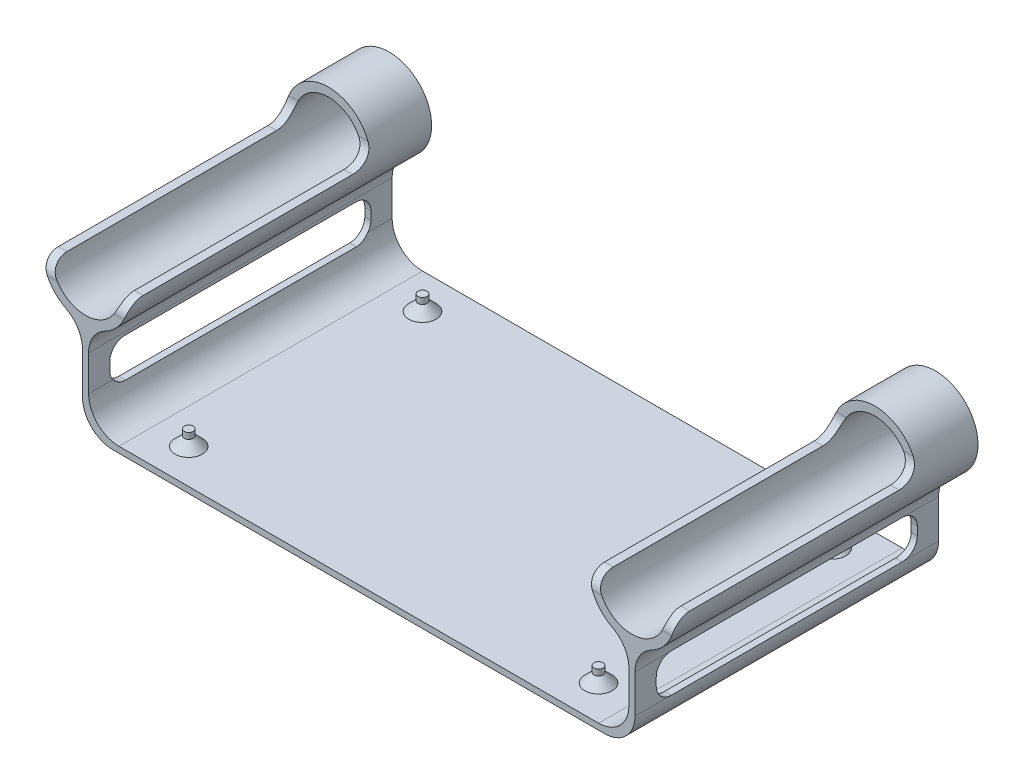
from build123d import *

# Parameters (mm, degrees)
SKETCH1_R           = 11.15
BOSS_EXTRUDE1_DEPTH = 100
FILLET1_R           = 10
SKETCH2_R           = 1.5
BOSS_EXTRUDE2_DEPTH = 5
CUT_EXTRUDE1_DEPTH  = 200
CHAMFER1_SIZE       = 3
SKETCH4_W           = 248.723360466
SKETCH4_H           = 67.445413608
CUT_EXTRUDE2_DEPTH  = 80
FILLET2_R           = 6
FILLET4_R           = 5


with BuildPart() as part:
    # Sketch1 → Boss-Extrude1 (new body)
    with BuildSketch(Plane.XY):
        with BuildLine():
            Line((180, -45), (181, -45))
            Line((181, -45), (181, -14.961450912))
            ThreePointArc((181, -14.961450912), (193.991057155, -0.496891277), (180, 13.002789132))
            ThreePointArc((180, 13.002789132), (166.008942845, -0.496891277), (179, -14.961450912))
            Line((179, -14.961450912), (179, -43))
            Line((179, -43), (1, -43))
            Line((1, -43), (1, -13.964240044))
            ThreePointArc((1, -13.964240044), (13.991057155, 0.500319591), (0, 14))
            ThreePointArc((0, 14), (-13.991057155, 0.500319591), (-1, -13.964240044))
            Line((-1, -13.964240044), (-1, -45))
            Line((-1, -45), (0, -45))
            Line((0, -45), (180, -45))
        make_face()
        Circle(SKETCH1_R, mode=Mode.SUBTRACT)
        with Locations((180, -0.997210868)):
            Circle(SKETCH1_R, mode=Mode.SUBTRACT)
    extrude(amount=BOSS_EXTRUDE1_DEPTH)

    # Fillet1
    fillet1_edges = [part.edges().sort_by_distance(p)[0] for p in [
        (181, -14.961450912, 50),
        (181, -45, 50),
        (-1, -45, 50),
        (-1, -13.964240044, 50),
        (1, -13.964240044, 50),
        (1, -43, 50),
        (179, -43, 50),
        (179, -14.961450912, 50),
    ]]
    fillet(fillet1_edges, radius=FILLET1_R)

    # Sketch2 → Boss-Extrude2 (add)
    with BuildSketch(Plane(origin=(0, -43, 0), x_dir=(1, 0, 0), z_dir=(0, 1, 0))):
        with Locations((157.5, -88.5)):
            Circle(SKETCH2_R)
        with Locations((22.5, -88.5)):
            Circle(SKETCH2_R)
        with Locations((22.5, -11.5)):
            Circle(SKETCH2_R)
        with Locations((157.5, -11.5)):
            Circle(SKETCH2_R)
    extrude(amount=BOSS_EXTRUDE2_DEPTH)

    # Sketch3 → Cut-Extrude1 (cut)
    with BuildSketch(Plane(origin=(181, 0, 0), x_dir=(0, 0, -1), z_dir=(1, 0, 0))):
        with BuildLine():
            Line((-88, -35), (-12, -35))
            ThreePointArc((-12, -35), (-8.464466094, -33.535533906), (-7, -30))
            Line((-7, -30), (-7, -27.327939876))
            ThreePointArc((-7, -27.327939876), (-8.464466094, -23.79240597), (-12, -22.327939876))
            Line((-12, -22.327939876), (-88, -22.327939876))
            ThreePointArc((-88, -22.327939876), (-91.535533906, -23.79240597), (-93, -27.327939876))
            Line((-93, -27.327939876), (-93, -30))
            ThreePointArc((-93, -30), (-91.535533906, -33.535533906), (-88, -35))
        make_face()
    extrude(amount=-CUT_EXTRUDE1_DEPTH, mode=Mode.SUBTRACT)

    # Chamfer1
    chamfer1_edges = [part.edges().sort_by_distance(p)[0] for p in [
        (21, -43, 88.5),
        (21, -43, 11.5),
        (156, -43, 11.5),
        (156, -43, 88.5),
    ]]
    chamfer(chamfer1_edges, length=CHAMFER1_SIZE)

    # Sketch4 → Cut-Extrude2 (cut)
    with BuildSketch(Plane.XY.offset(100)):
        with Locations((82.703627743, 32.722706804)):
            Rectangle(SKETCH4_W, SKETCH4_H)
    extrude(amount=-CUT_EXTRUDE2_DEPTH, mode=Mode.SUBTRACT)

    # Fillet2
    # the kernel refuses this fillet: 6 mm, written as the material it adds along each edge
    with BuildSketch(Plane(origin=(3.894933589, -1, 20), x_dir=(0, 0, 1), z_dir=(-1, 0, 0))) as fillet2_piece_1_section:
        with BuildLine():
            CenterArc((FILLET2_R, FILLET2_R), FILLET2_R, 180, 90)
            Line((0, FILLET2_R), (0, 0))
            Line((0, 0), (FILLET2_R, 0))
        make_face()
    fillet2_piece_1 = extrude(amount=32.859173632, mode=Mode.PRIVATE)
    fillet2_piece_1 = fillet2_piece_1 & Plane(origin=(0, 0, 21.353216392), x_dir=(0.07142857142857159, -0.9974457174120672, 0), z_dir=(0, 0, -1)) * Cylinder(14, 90, mode=Mode.PRIVATE)
    fillet2_piece_1 = fillet2_piece_1 - Plane(origin=(0, 0, 21.353216392), x_dir=(1, 0, 0), z_dir=(0, 0, -1)) * Cylinder(11.15, 90, mode=Mode.PRIVATE)
    add(fillet2_piece_1)
    with BuildSketch(Plane(origin=(28.964240044, -1, 20), x_dir=(0, 0, 1), z_dir=(-1, 0, 0))) as fillet2_piece_2_section:
        with BuildLine():
            CenterArc((FILLET2_R, FILLET2_R), FILLET2_R, 180, 90)
            Line((0, FILLET2_R), (0, 0))
            Line((0, 0), (FILLET2_R, 0))
        make_face()
    fillet2_piece_2 = extrude(amount=32.859173632, mode=Mode.PRIVATE)
    fillet2_piece_2 = fillet2_piece_2 & Plane(origin=(0, 0, 21.353217429), x_dir=(0.07142857142857159, -0.9974457174120672, 0), z_dir=(0, 0, -1)) * Cylinder(14, 90, mode=Mode.PRIVATE)
    fillet2_piece_2 = fillet2_piece_2 - Plane(origin=(0, 0, 21.353217429), x_dir=(1, 0, 0), z_dir=(0, 0, -1)) * Cylinder(11.15, 90, mode=Mode.PRIVATE)
    add(fillet2_piece_2)
    with BuildSketch(Plane(origin=(183.850000349, -1, 20), x_dir=(0, 0, 1), z_dir=(-1, 0, 0))) as fillet2_piece_3_section:
        with BuildLine():
            CenterArc((FILLET2_R, FILLET2_R), FILLET2_R, 180, 90)
            Line((0, FILLET2_R), (0, 0))
            Line((0, 0), (FILLET2_R, 0))
        make_face()
    fillet2_piece_3 = extrude(amount=32.850000071, mode=Mode.PRIVATE)
    fillet2_piece_3 = fillet2_piece_3 & Plane(origin=(180, -0.997210868, 21.346352068), x_dir=(0.07142857142857144, -0.9974457174120673, 0), z_dir=(0, 0, -1)) * Cylinder(14, 90, mode=Mode.PRIVATE)
    fillet2_piece_3 = fillet2_piece_3 - Plane(origin=(180, -0.997210868, 21.346352068), x_dir=(1, 0, 0), z_dir=(0, 0, -1)) * Cylinder(11.15, 90, mode=Mode.PRIVATE)
    add(fillet2_piece_3)
    with BuildSketch(Plane(origin=(208.999999722, -1, 20), x_dir=(0, 0, 1), z_dir=(-1, 0, 0))) as fillet2_piece_4_section:
        with BuildLine():
            CenterArc((FILLET2_R, FILLET2_R), FILLET2_R, 180, 90)
            Line((0, FILLET2_R), (0, 0))
            Line((0, 0), (FILLET2_R, 0))
        make_face()
    fillet2_piece_4 = extrude(amount=32.850000071, mode=Mode.PRIVATE)
    fillet2_piece_4 = fillet2_piece_4 & Plane(origin=(180, -0.997210868, 21.346352722), x_dir=(0.07142857142857144, -0.9974457174120673, 0), z_dir=(0, 0, -1)) * Cylinder(14, 90, mode=Mode.PRIVATE)
    fillet2_piece_4 = fillet2_piece_4 - Plane(origin=(180, -0.997210868, 21.346352722), x_dir=(1, 0, 0), z_dir=(0, 0, -1)) * Cylinder(11.15, 90, mode=Mode.PRIVATE)
    add(fillet2_piece_4)

    # Fillet4
    fillet4_edges = [part.edges().sort_by_distance(p)[0] for p in [
        (12.534653228, -1, 100),
        (-12.534653228, -1, 100),
        (192.574999687, -1, 100),
        (167.425000313, -1, 100),
    ]]
    fillet(fillet4_edges, radius=FILLET4_R)


solid = part.part
